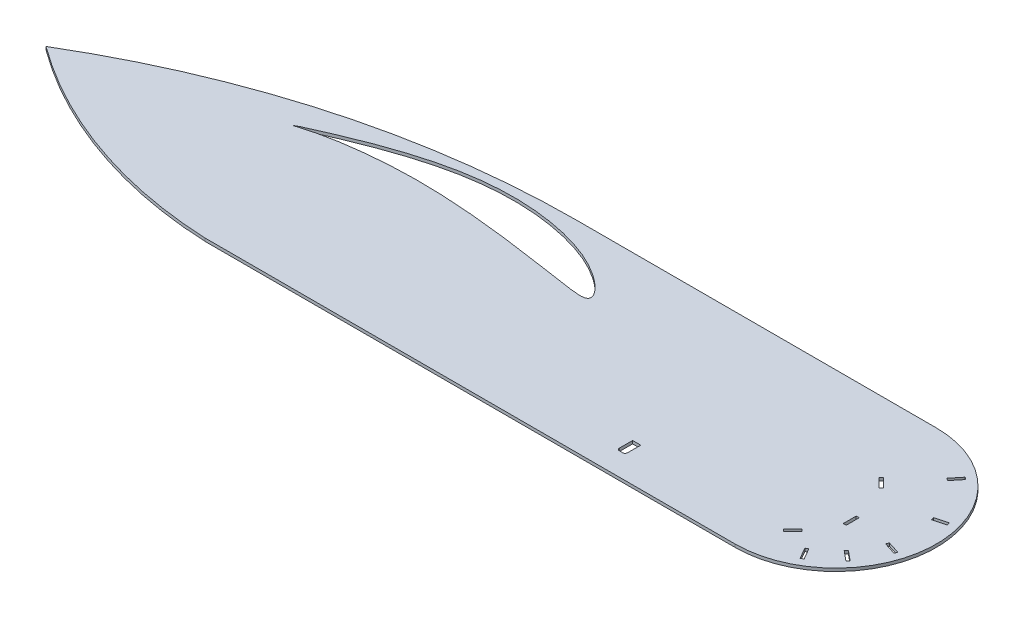
from build123d import *

# Parameters (mm, degrees)
BOSS_EXTRUDE1_DEPTH = 3
SKETCH2_W           = 3
SKETCH2_H           = 13
CUT_EXTRUDE1_DEPTH  = 924.723412329


with BuildPart() as part:
    # Sketch1 → Boss-Extrude1 (new body)
    with BuildSketch(Plane(origin=(0, 0, 0), x_dir=(1, 0, 0), z_dir=(0, 1, 0))):
        with BuildLine():
            Line((266.408252791, 0), (800, 0))
            ThreePointArc((800, 0), (901.249284204, 101.249284204), (800, 202.498568407))
            Line((800, 202.498568407), (438.319179988, 202.498568407))
            ThreePointArc((438.319179988, 202.498568407), (221.044276809, 173.066910271), (19.429068043, 86.893169221))
            ThreePointArc((19.429068043, 86.893169221), (136.475600537, 25.133273094), (266.408252791, 0))
        make_face()
    extrude(amount=BOSS_EXTRUDE1_DEPTH)

    # Sketch2 → Cut-Extrude1 (cut, through all)
    with BuildSketch(Plane.XZ):
        Polygon((823.689305431, -121.232773416), (814.496917276, -130.425161571), (816.618237619, -132.546481915), (825.810625775, -123.354093759), align=None)
        Polygon((841.197249001, -32.961563396), (847.702049467, -21.706006062), (845.104613159, -20.204898262), (838.599812693, -31.460455596), align=None)
        with Locations((837.956551938, -78.816857662)):
            Rectangle(SKETCH2_W, SKETCH2_H)
        with BuildLine():
            Line((212.57, -142.261782597), (212.57, -142.294782597))
            add(Edge.make_bspline(
                [(212.57, -142.294782597), (212.815137814, -142.460102486), (213.721483955, -143.071338431), (215.664179604, -144.220627165), (218.723437449, -145.777902142), (222.783765044, -147.580430449), (227.75908382, -149.780753256), (233.673151887, -152.372942719), (243.334631626, -156.473964415), (254.071597155, -160.928560196), (265.811315632, -165.551386352), (275.559769605, -169.192616013), (285.820264156, -172.789650289), (300.213165162, -177.442893994), (315.047470761, -181.61442891), (330.216772764, -185.078244178), (341.716798025, -187.262793988), (353.238408154, -188.970546018), (364.74982071, -190.189827969), (376.222154657, -190.889317525), (387.611451467, -191.086885836), (398.853751386, -190.764655348), (413.421420996, -189.696341642), (427.580802498, -187.700042396), (441.195366572, -184.827458978), (450.821943115, -182.319735681), (459.948918056, -179.469695278), (468.511745548, -176.287644359), (476.453624938, -172.824739179), (483.715148146, -169.128859345), (490.24814377, -165.284833696), (496.019667562, -161.40694583), (500.998027396, -157.585747413), (505.147593549, -153.884087589), (508.447339472, -150.382728864), (510.852240131, -147.180842115), (512.23052565, -144.518995071), (512.672376723, -142.438033672), (512.365957104, -140.693980261), (510.836297954, -139.267947677), (508.300825673, -138.604557497), (504.990749494, -138.396901122), (500.845143819, -138.632879923), (495.886387834, -139.207005807), (490.127383335, -140.033765729), (483.600688534, -141.01415409), (476.345974836, -142.081971784), (468.41886468, -143.270863791), (459.86962452, -144.552957933), (447.40415706, -146.414008038), (434.302787697, -148.29198326), (413.230560269, -151.080307043), (394.916461571, -153.170522792), (372.413070638, -155.185169178), (353.278576878, -156.497400442), (334.10390548, -157.12050793), (318.83753012, -157.119300437), (307.569298967, -156.863067348), (296.54483902, -156.342386113), (285.853643217, -155.59861473), (275.586288909, -154.654588864), (265.829573747, -153.556930461), (256.673464041, -152.312824912), (248.205041684, -150.95854436), (240.510067524, -149.523302558), (233.666056009, -148.064077742), (227.735558734, -146.629571507), (222.771530443, -145.20558608), (218.774640723, -143.912633605), (215.724793866, -142.995242016), (213.753356987, -142.496728121), (212.816237246, -142.310670921), (212.57, -142.261782597)],
                knots=[0, 0, 0, 0, 0.001413477, 0.005226038, 0.010781091, 0.017815608, 0.026460951, 0.036790889, 0.048685593, 0.076639155, 0.092362872, 0.109003461, 0.126386903, 0.144339126, 0.181312719, 0.200023431, 0.218712626, 0.237261299, 0.255692478, 0.274037197, 0.292192583, 0.310132767, 0.327788163, 0.362001934, 0.378421226, 0.394286639, 0.40954344, 0.424114253, 0.43793778, 0.450941833, 0.463044023, 0.474154417, 0.484164575, 0.493023962, 0.500713088, 0.507125739, 0.512129705, 0.514904185, 0.517171427, 0.520261618, 0.5242453, 0.529497961, 0.536092185, 0.54406114, 0.553363127, 0.563904543, 0.575614949, 0.588420092, 0.60222661, 0.616944448, 0.648675826, 0.665501113, 0.718564132, 0.736789145, 0.773513212, 0.810244924, 0.828488569, 0.846493195, 0.864125178, 0.88124851, 0.897725282, 0.913415058, 0.928184346, 0.941897285, 0.954411455, 0.965602702, 0.975349728, 0.983575522, 0.990284579, 0.99543259, 0.998799869, 1, 1, 1, 1], degree=3))
        make_face()
        with BuildLine():
            Line((658.07, -25.47338103), (658.07, -38.67338103))
            Line((658.07, -38.67338103), (666.27, -38.67338103))
            Line((666.27, -38.67338103), (666.27, -25.47338103))
            ThreePointArc((666.27, -25.47338103), (665.537766953, -23.705614077), (663.77, -22.97338103))
            Line((663.77, -22.97338103), (660.57, -22.97338103))
            ThreePointArc((660.57, -22.97338103), (658.802233047, -23.705614077), (658.07, -25.47338103))
        make_face()
        Polygon((849.21458433, -164.005565384), (857.427776257, -174.082443788), (859.753209735, -172.187091805), (851.540017808, -162.110213401), align=None)
        Polygon((876.759798116, -122.890899938), (889.336145671, -126.182629298), (890.095775523, -123.280395247), (877.519427968, -119.988665887), align=None)
        Polygon((876.494039563, -78.686304576), (888.891550999, -74.774564529), (887.988841757, -71.913600351), (875.591330322, -75.825340399), align=None)
        Polygon((862.379211556, -51.55763396), (872.393174091, -43.267847813), (870.480146518, -40.956933382), (860.466183984, -49.246719529), align=None)
        Polygon((822.408918341, -44.734564453), (813.216530186, -35.542176297), (811.095209842, -37.663496641), (820.287597998, -46.855884796), align=None)
    extrude(amount=-CUT_EXTRUDE1_DEPTH, mode=Mode.SUBTRACT)


solid = part.part
